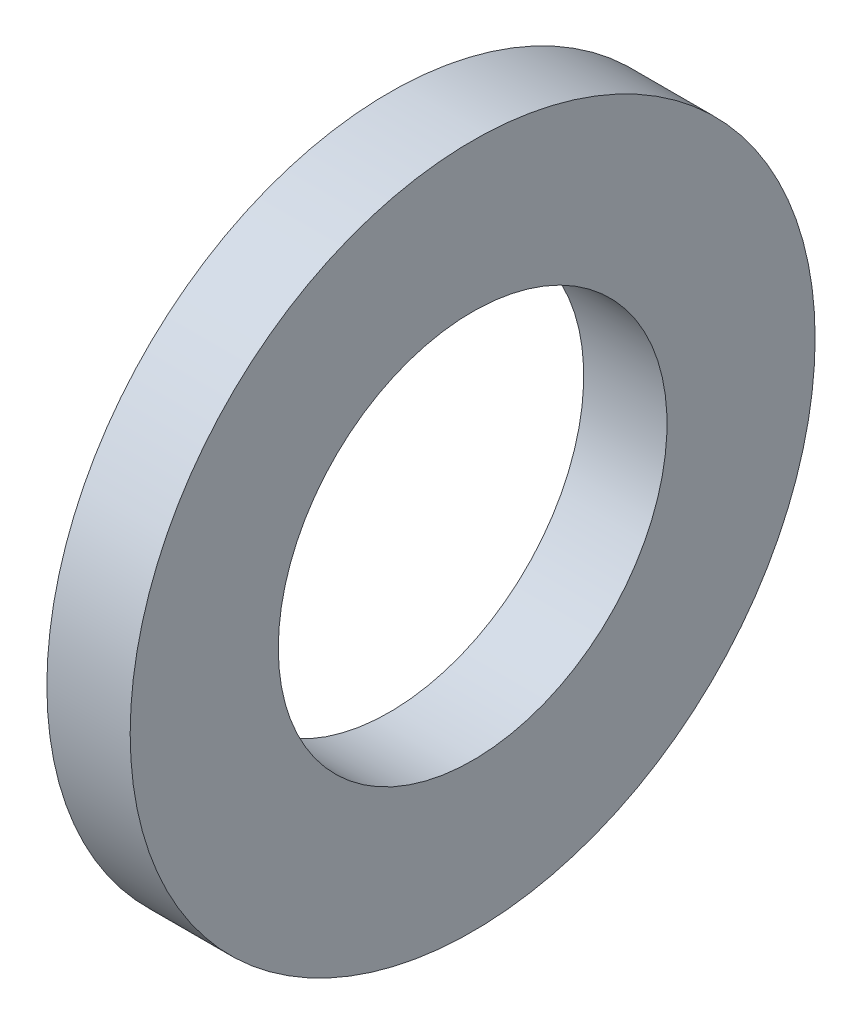
from build123d import *

# Parameters (mm, degrees)
SKETCH1_W = 4.5
SKETCH1_H = 8


with BuildPart() as part:
    # Sketch1 → Base-Revolve (revolve)
    with BuildSketch(Plane.XY):
        with Locations((-2.25, 14.5)):
            Rectangle(SKETCH1_W, SKETCH1_H)
    revolve(axis=Axis((-34.925, 0, 0), (1, 0, 0)))


solid = part.part
